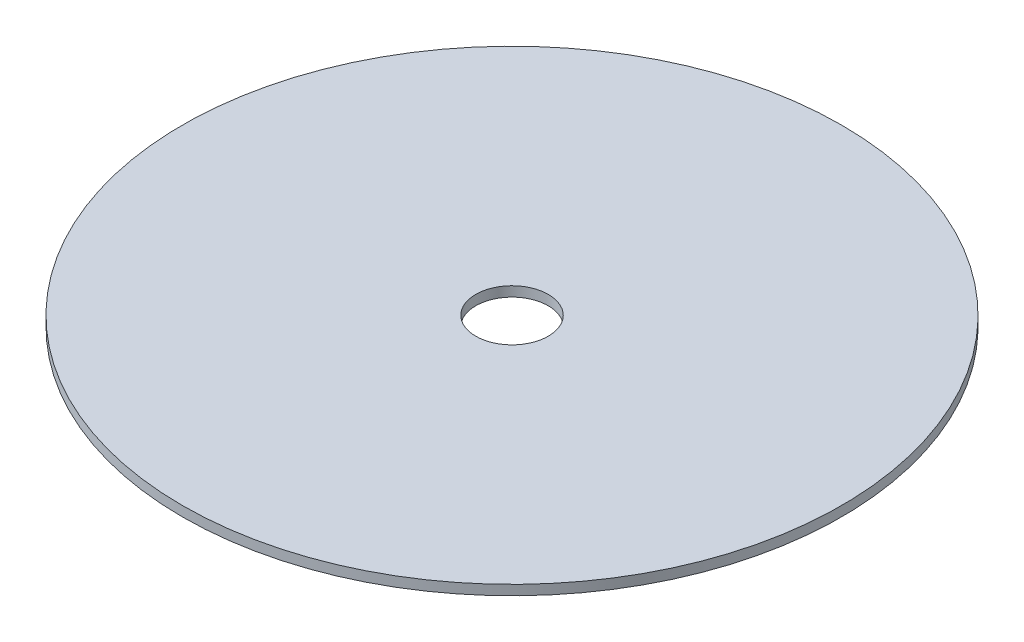
from build123d import *

# Parameters (mm, degrees)
ESQUISSE2_W             = 100
ESQUISSE2_H             = 3
ESQUISSE4_R             = 11
ENL_V_MAT_EXTRU_6_DEPTH = 142.453172464


with BuildPart() as part:
    # Esquisse2 → MainRevolution (revolve)
    with BuildSketch(Plane.XY):
        with Locations((50, 1.5)):
            Rectangle(ESQUISSE2_W, ESQUISSE2_H)
    revolve(axis=Axis((0, 55, 0), (0, -1, 0)))

    # Esquisse4 → Enlèv. mat.-Extru.6 (cut, through all)
    with BuildSketch(Plane(origin=(0, 3, 0), x_dir=(1, 0, 0), z_dir=(0, 1, 0))):
        Circle(ESQUISSE4_R)
    extrude(amount=-ENL_V_MAT_EXTRU_6_DEPTH, mode=Mode.SUBTRACT)


solid = part.part
